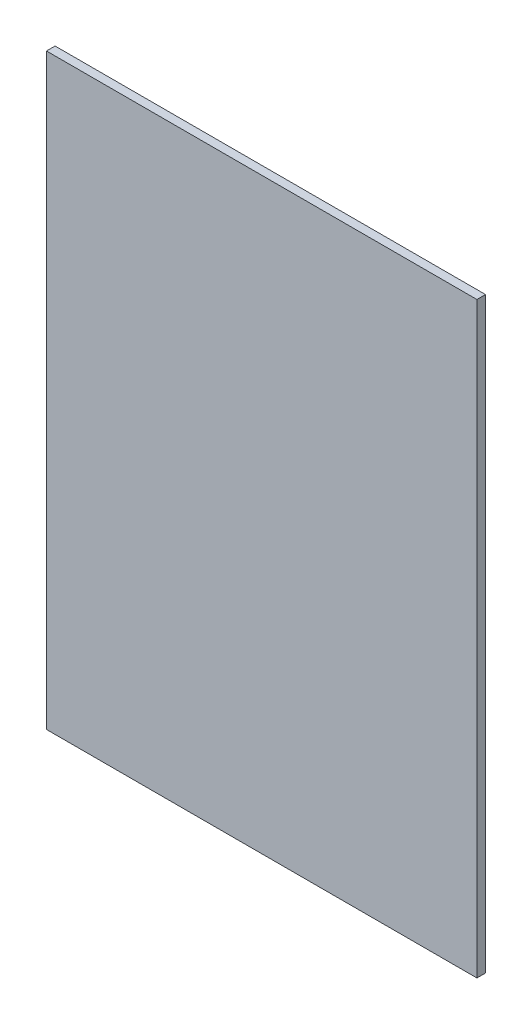
from build123d import *

# Parameters (mm, degrees)
SKETCH_1_W             = 100
SKETCH_1_H             = 136.5
SM_BASE_FLANGE_1_DEPTH = 2


# Sheet-metal steps are written as plain solids
with BuildPart() as part:
    # Sketch 1 → 基体-法兰1 (new body)
    with BuildSketch(Plane.XY):
        Rectangle(SKETCH_1_W, SKETCH_1_H)
    extrude(amount=-SM_BASE_FLANGE_1_DEPTH)


solid = part.part
